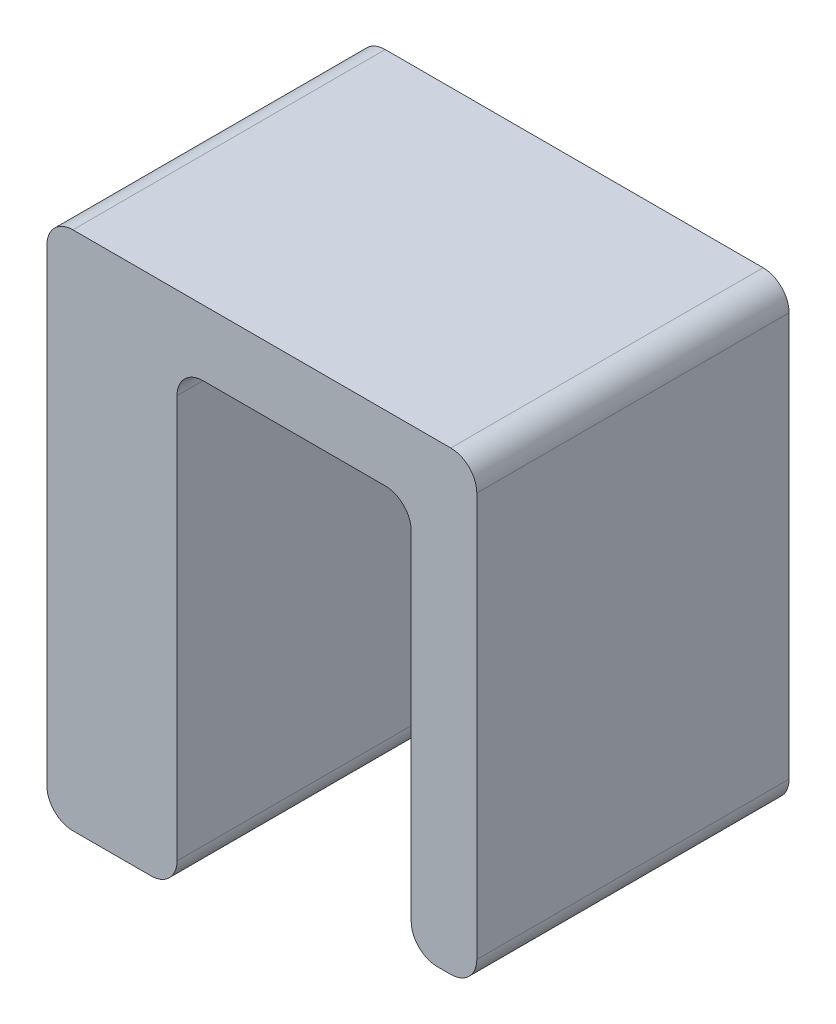
from build123d import *

# Parameters (mm, degrees)
BOSS_EXTRUDE1_DEPTH = 7.62
FILLET1_R           = 0.635


with BuildPart() as part:
    # Sketch1 → Boss-Extrude1 (new body)
    with BuildSketch(Plane.XY):
        Polygon((0, 0), (0, 12.7), (10.49, 12.7), (10.49, 1.575), (8.89, 1.575), (8.89, 11.1), (3.175, 11.1), (3.175, 0), align=None)
    extrude(amount=BOSS_EXTRUDE1_DEPTH)

    # Fillet1
    fillet1_edges = [part.edges().sort_by_distance(p)[0] for p in [
        (8.89, 11.1, 3.81),
        (3.175, 11.1, 3.81),
        (3.175, 0, 3.81),
        (0, 0, 3.81),
        (8.89, 1.575, 3.81),
        (10.49, 1.575, 3.81),
        (0, 12.7, 3.81),
        (10.49, 12.7, 3.81),
    ]]
    fillet(fillet1_edges, radius=FILLET1_R)


solid = part.part
